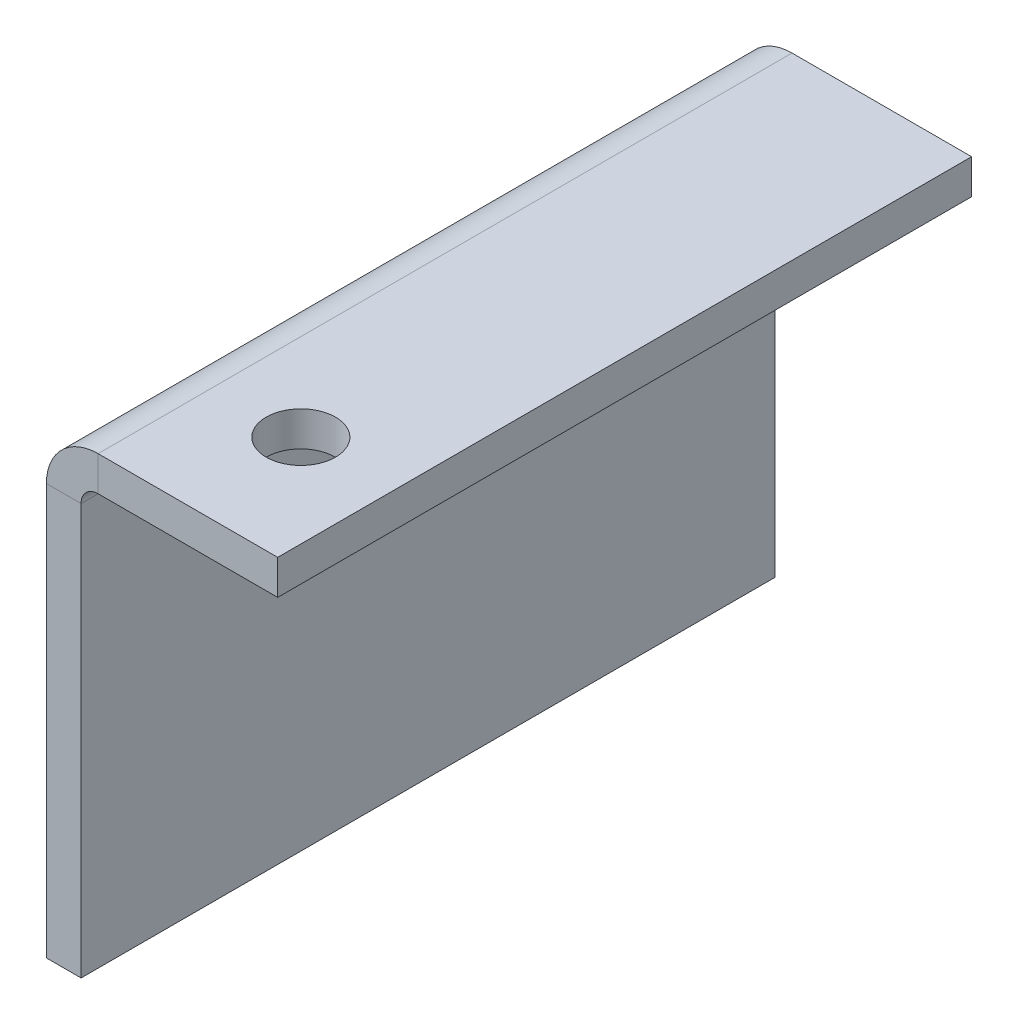
from build123d import *

# Parameters (mm, degrees)
BASE_FLANGE1_DEPTH    = 30
F_3_0MM_DOWEL_HOLE1_D = 3


# Sheet-metal steps are written as plain solids
with BuildPart() as part:
    # Sketch1 → Base-Flange1 (new body)
    with BuildSketch(Plane.XY):
        with BuildLine():
            Line((0, 0), (0, 17.7634))
            ThreePointArc((0, 17.7634), (0.655084973, 19.344915027), (2.2366, 20))
            Line((2.2366, 20), (10, 20))
            Line((10, 20), (10, 18.5))
            Line((10, 18.5), (2.2366, 18.5))
            ThreePointArc((2.2366, 18.5), (1.715745145, 18.284254855), (1.5, 17.7634))
            Line((1.5, 17.7634), (1.5, 0))
            Line((1.5, 0), (0, 0))
        make_face()
    extrude(amount=BASE_FLANGE1_DEPTH)

    # Ø3.0mm Dowel Hole1 (through all)
    with Locations(Plane(origin=(5.118724392, 18.5, 37.745569698), x_dir=(-1, 0, 0), z_dir=(0, -1, 0))):
        with Locations((-0.881275608, 12.745569698)):
            Hole(F_3_0MM_DOWEL_HOLE1_D / 2)


solid = part.part
